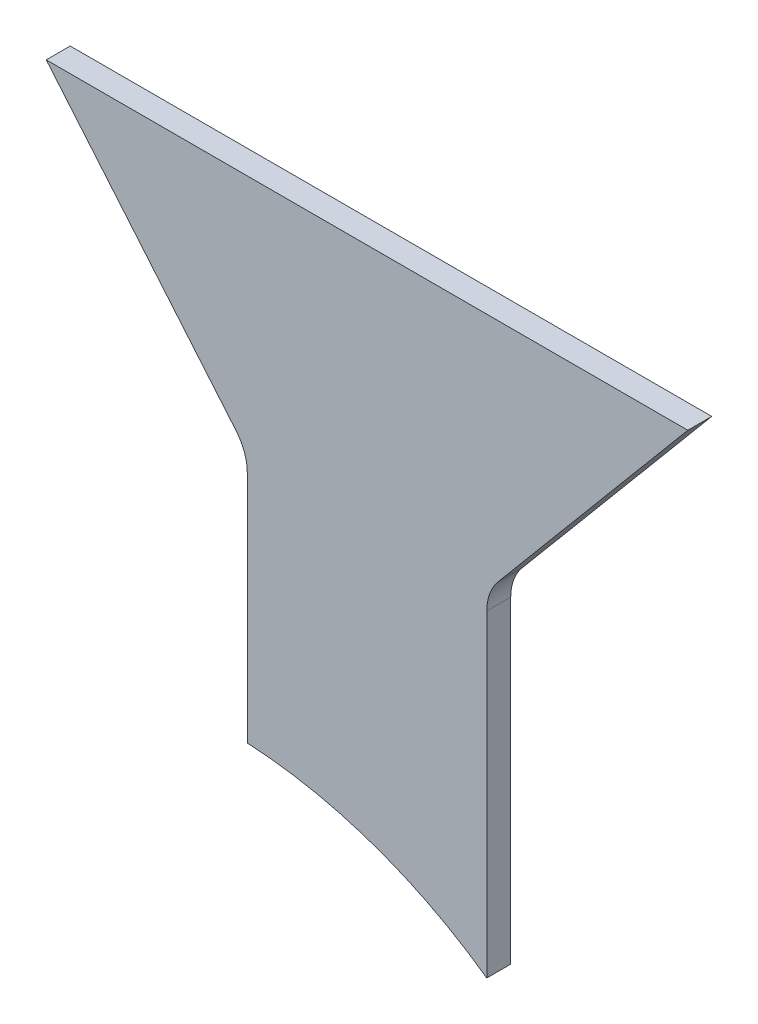
from build123d import *

# Parameters (mm, degrees)
FUNNEL_SIDE_PANEL_DEPTH = 5
FILLET1_R               = 10


with BuildPart() as part:
    # Sketch1 → Funnel - Side Panel (new body)
    with BuildSketch(Plane.XY):
        with BuildLine():
            Line((25, 0), (25, 70))
            Line((25, 70), (66.974030913, 120.022702136))
            Line((66.974030913, 120.022702136), (-66.974030913, 120.022702136))
            Line((-66.974030913, 120.022702136), (-25, 70))
            Line((-25, 70), (-25, 17.5))
            ThreePointArc((-25, 17.5), (1.244471309, 12.305632311), (25, 0))
        make_face()
    extrude(amount=FUNNEL_SIDE_PANEL_DEPTH)

    # Fillet1
    fillet1_edges = [part.edges().sort_by_distance(p)[0] for p in [
        (-25, 70, 2.5),
        (25, 70, 2.5),
    ]]
    fillet(fillet1_edges, radius=FILLET1_R)


solid = part.part
